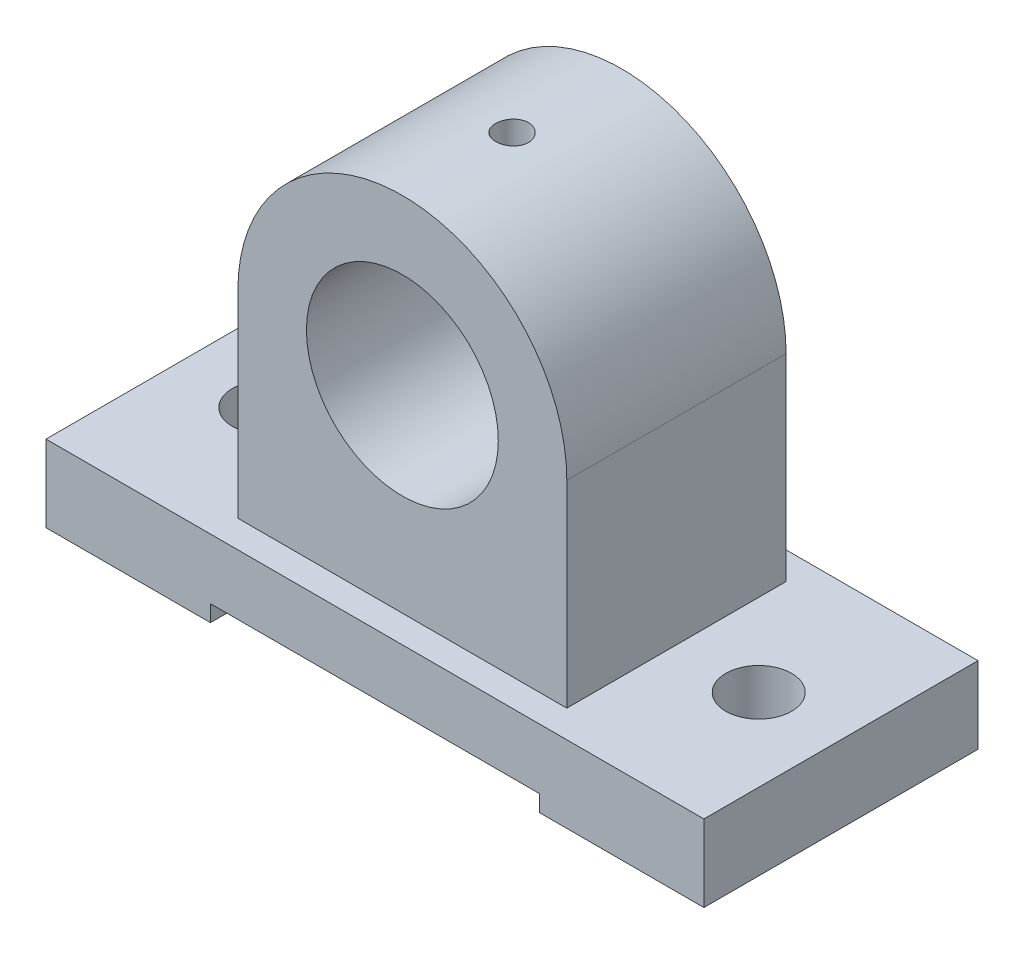
from build123d import *

# Parameters (mm, degrees)
SKETCH_1_W          = 120
SKETCH_1_H          = 50
EXTRUDE_1_DEPTH     = 14
EXTRUDE_START       = -20
EXTRUDE_3_DEPTH     = 40
SKETCH_4_R          = 17.5
CUT_EXTRUDE_1_DEPTH = 112.803398875
SKETCH_5_W          = 60
SKETCH_5_H          = 50
CUT_EXTRUDE_2_DEPTH = 3
SKETCH_6_R          = 6
CUT_EXTRUDE_3_DEPTH = 93.633687177
SKETCH_7_R          = 3
CUT_EXTRUDE_4_DEPTH = 13


# Read off the part's stored shape, not the designer's step: 凸台-拉伸3
with BuildPart() as part:
    # 草图1 → 凸台-拉伸1 (new body)
    with BuildSketch(Plane(origin=(0, 0, 0), x_dir=(1, 0, 0), z_dir=(0, 1, 0))):
        Rectangle(SKETCH_1_W, SKETCH_1_H)
    extrude(amount=EXTRUDE_1_DEPTH)

    # 凸台-拉伸3 outline → 凸台-拉伸3 (add)
    with BuildSketch(Plane.XY.offset(EXTRUDE_START)):
        with BuildLine():
            Line((30, 14), (30, 50))
            ThreePointArc((30, 50), (0, 80), (-30, 50))
            Line((-30, 50), (-30, 14))
            Line((-30, 14), (30, 14))
        make_face()
    extrude(amount=EXTRUDE_3_DEPTH)

    # 草图4 → 切除-拉伸1 (cut, through all)
    with BuildSketch(Plane.XY.offset(25)):
        with Locations(Location((0, 50, 0), (0, 0, 180))):
            Circle(SKETCH_4_R)
    extrude(amount=-CUT_EXTRUDE_1_DEPTH, mode=Mode.SUBTRACT)

    # 草图5 → 切除-拉伸2 (cut)
    with BuildSketch(Plane(origin=(0, 0, 0), x_dir=(1, 0, 0), z_dir=(0, 1, 0))):
        Rectangle(SKETCH_5_W, SKETCH_5_H)
    extrude(amount=CUT_EXTRUDE_2_DEPTH, mode=Mode.SUBTRACT)

    # 草图6 → 切除-拉伸3 (cut, through all)
    with BuildSketch(Plane(origin=(0, 14, 0), x_dir=(1, 0, 0), z_dir=(0, 1, 0))):
        with Locations(Location((-45, 0, 0), (0, 0, 270))):
            Circle(SKETCH_6_R)
        with Locations(Location((45, 0, 0), (0, 0, 270))):
            Circle(SKETCH_6_R)
    extrude(amount=-CUT_EXTRUDE_3_DEPTH, mode=Mode.SUBTRACT)

    # 草图7 → 切除-拉伸4 (cut)
    with BuildSketch(Plane(origin=(0, 80, 0), x_dir=(1, 0, 0), z_dir=(0, 1, 0))):
        with Locations(Location((0, 0, 0), (0, 0, 270))):
            Circle(SKETCH_7_R)
    extrude(amount=-CUT_EXTRUDE_4_DEPTH, mode=Mode.SUBTRACT)


solid = part.part
